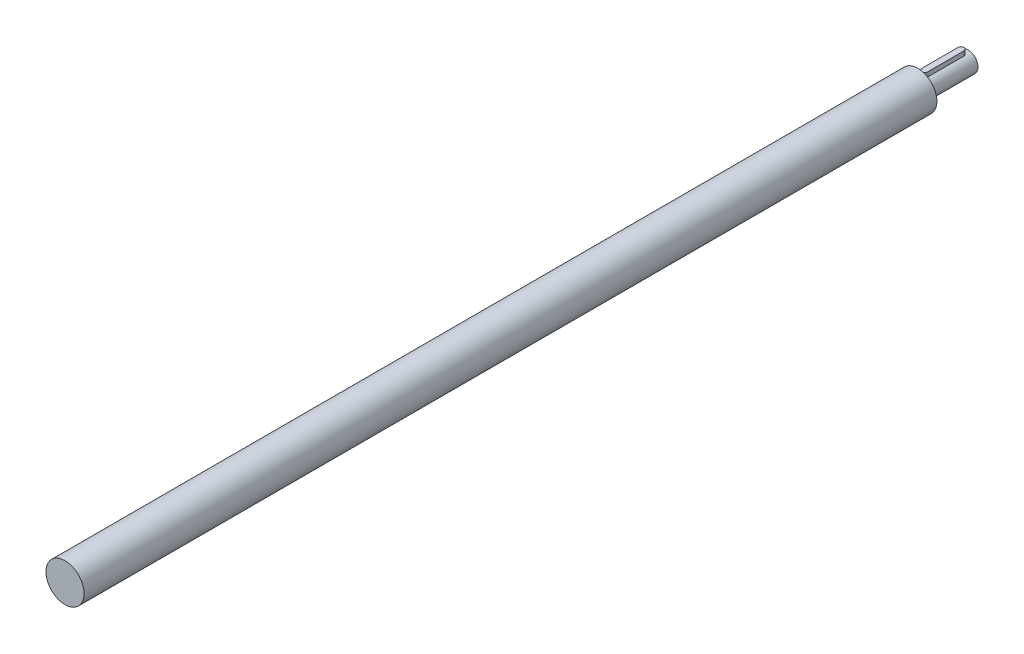
from build123d import *

# Parameters (mm, degrees)
SZKIC1_R                    = 9.5
DODANIE_WYCI_GNI_CIE1_DEPTH = 425
SZKIC2_R                    = 5
DODANIE_WYCI_GNI_CIE2_DEPTH = 25
SZKIC3_W                    = 3
SZKIC3_H                    = 7
DODANIE_WYCI_GNI_CIE3_DEPTH = 21
ZAOKR_GLENIE2_R             = 1.5
ZAOKR_GLENIE3_R             = 1.5


with BuildPart() as part:
    # Szkic1 → Dodanie-wyciągnięcie1 (new body)
    with BuildSketch(Plane.XY):
        Circle(SZKIC1_R)
    extrude(amount=DODANIE_WYCI_GNI_CIE1_DEPTH)

    # Szkic2 → Dodanie-wyciągnięcie2 (add)
    with BuildSketch(Plane(origin=(0, 0, 0), x_dir=(-1, 0, 0), z_dir=(0, 0, -1))):
        Circle(SZKIC2_R)
    extrude(amount=DODANIE_WYCI_GNI_CIE2_DEPTH)

    # Szkic3 → Dodanie-wyciągnięcie3 (add)
    with BuildSketch(Plane(origin=(0, 0, -2), x_dir=(-1, 0, 0), z_dir=(0, 0, -1))):
        with Locations((0, 3.5)):
            Rectangle(SZKIC3_W, SZKIC3_H)
    extrude(amount=DODANIE_WYCI_GNI_CIE3_DEPTH)

    # Zaokrąglenie2
    zaokr_glenie2_edges = [part.edges().sort_by_distance(p)[0] for p in [
        (-1.5, 5.884848004, -23),
    ]]
    fillet(zaokr_glenie2_edges, radius=ZAOKR_GLENIE2_R)

    # Zaokrąglenie3
    zaokr_glenie3_edges = [part.edges().sort_by_distance(p)[0] for p in [
        (1.5, 5.884848004, -2),
        (-1.5, 5.884848004, -2),
        (1.5, 5.884848004, -23),
    ]]
    fillet(zaokr_glenie3_edges, radius=ZAOKR_GLENIE3_R - 0.0001)  # a hair under: the kernel refuses the full size


solid = part.part
